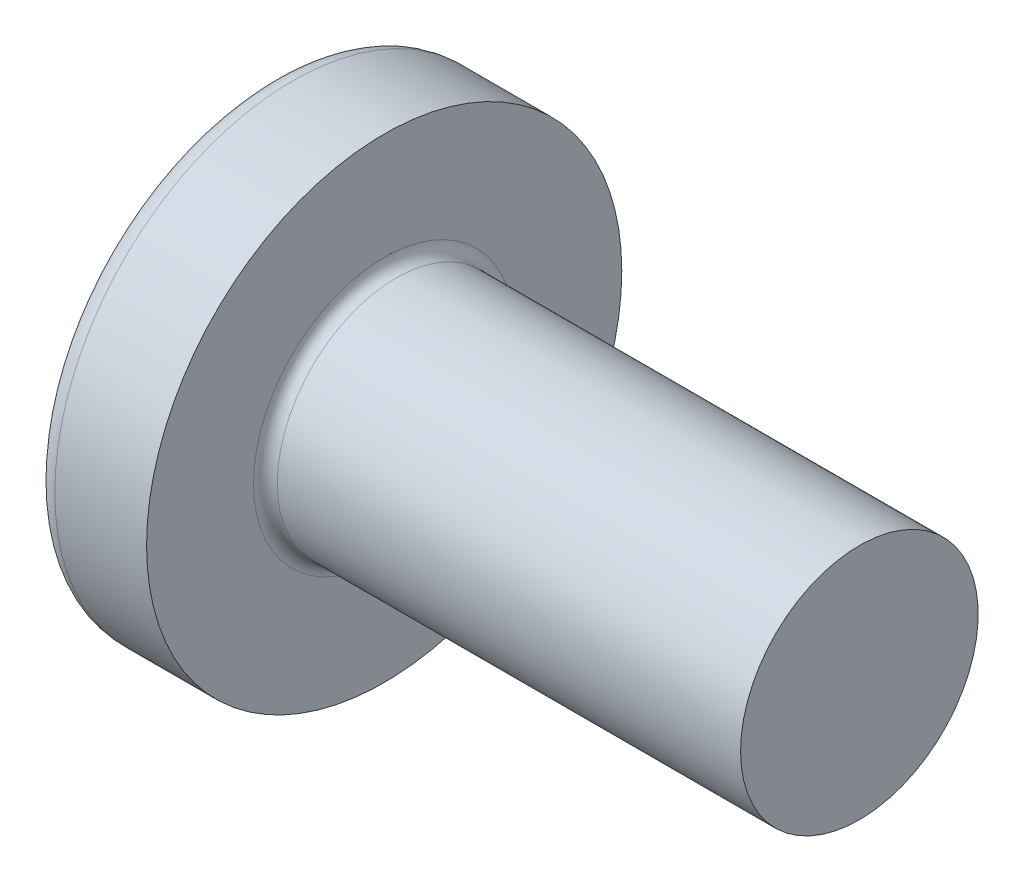
from build123d import *

# Parameters (mm, degrees)
RECPAT_COUNT = 2
RECPAT_ANGLE = 90


with BuildPart() as part:
    # Fillet1: read off the stored shape, not the designer's step
    # Fillet1 outline → Fillet1 (revolve)
    with BuildSketch(Plane.YX):
        with BuildLine():
            Line((2, 3.3), (2, 11.1))
            Line((2, 11.1), (0, 11.1))
            Line((0, 11.1), (0, 0))
            ThreePointArc((0, 0), (2.027933458, 0.324444488), (3.853420198, 1.265388956))
            ThreePointArc((3.853420198, 1.265388956), (3.961271902, 1.392873227), (4, 1.555305874))
            Line((4, 1.555305874), (4, 3.1))
            Line((4, 3.1), (2.2, 3.1))
            ThreePointArc((2.2, 3.1), (2.058578644, 3.158578644), (2, 3.3))
        make_face()
    revolve(axis=Axis((0, 0, 0), (1, 0, 0)))

    # Sketch3 → Recess section 0
    with BuildSketch(Plane(origin=(0, 0, 0), x_dir=(0, 0, -1), z_dir=(1, 0, 0))):
        with BuildLine():
            Line((0.515, -2.15), (-0.515, -2.15))
            Line((-0.515, -2.15), (-0.515, 2.15))
            Line((-0.515, 2.15), (0.515, 2.15))
            Line((0.515, 2.15), (0.515, -2.15))
        make_face()
    # Sketch4 → Recess section 1
    with BuildSketch(Plane(origin=(2.34, 0, 0), x_dir=(0, 0, -1), z_dir=(1, 0, 0))):
        with BuildLine():
            Line((0.515, -0.983319232), (-0.515, -0.983319232))
            Line((-0.515, -0.983319232), (-0.515, 0.983319232))
            Line((-0.515, 0.983319232), (0.515, 0.983319232))
            Line((0.515, 0.983319232), (0.515, -0.983319232))
        make_face()
    recess = loft(mode=Mode.SUBTRACT)

    # RecPat: Recess ×2 about axis
    recpat_axis = Axis((0, 0, 0), (1, 0, 0))
    for i in range(1, RECPAT_COUNT):
        add(recess.rotate(recpat_axis, i * RECPAT_ANGLE / (RECPAT_COUNT - 1)), mode=Mode.SUBTRACT)

    # RecCorSke → RecessCore (revolve, cut)
    with BuildSketch(Plane.XY, mode=Mode.PRIVATE) as recesscore_sk:
        Polygon((0, 0), (0, 1.01462874), (2.34, 0.851), (2.616506661, 0), align=None)
    revolve(recesscore_sk.sketch.rotate(Axis((-3.175, 0, 0), (1, 0, 0)), 90), axis=Axis((-3.175, 0, 0), (1, 0, 0)), mode=Mode.SUBTRACT)


solid = part.part
